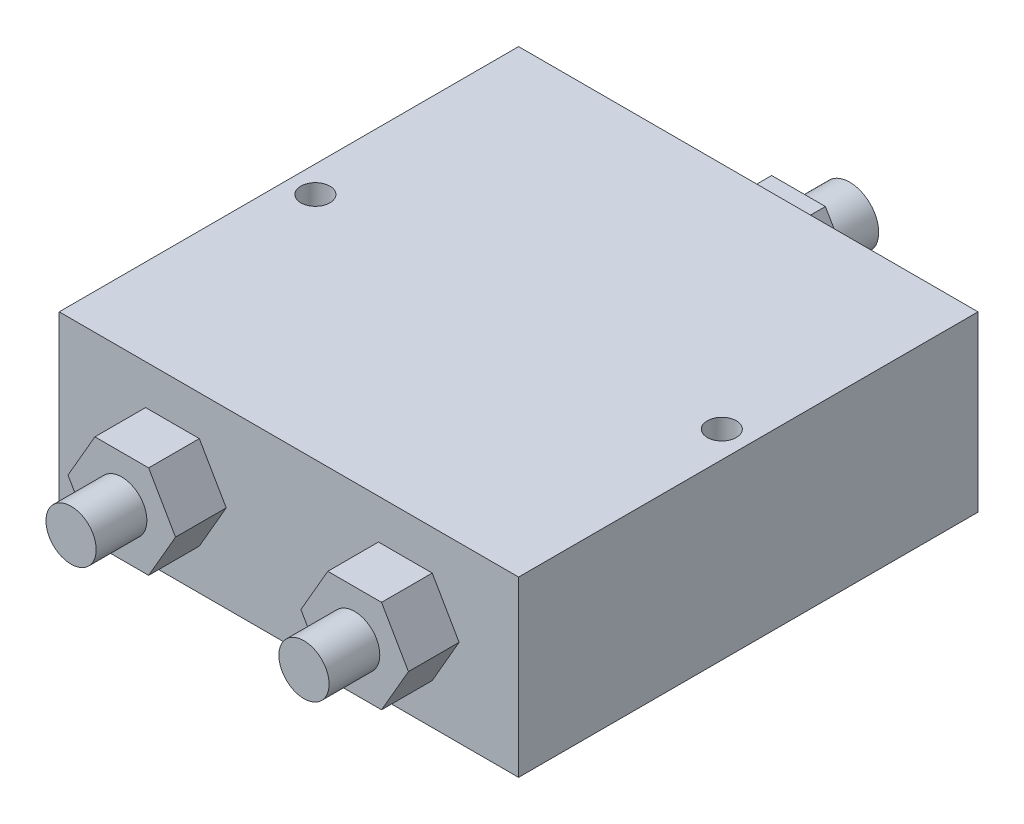
from build123d import *

# Parameters (mm, degrees)
SKETCH1_W           = 50.3
SKETCH1_H           = 50.3
BOSS_EXTRUDE1_DEPTH = 19
BOSS_EXTRUDE2_DEPTH = 5.55
BOSS_EXTRUDE3_DEPTH = 5.55
SKETCH5_R           = 3.175
BOSS_EXTRUDE4_DEPTH = 5.55
SKETCH7_R           = 2.75
BOSS_EXTRUDE5_DEPTH = 5.55
SKETCH8_R           = 1.59
CUT_EXTRUDE1_DEPTH  = 49.037329235


with BuildPart() as part:
    # Sketch1 → Boss-Extrude1 (new body)
    with BuildSketch(Plane(origin=(0, 0, 0), x_dir=(1, 0, 0), z_dir=(0, 1, 0))):
        Rectangle(SKETCH1_W, SKETCH1_H)
    extrude(amount=BOSS_EXTRUDE1_DEPTH)

    # Sketch2 → Boss-Extrude2 (add)
    with BuildSketch(Plane.XY.offset(25.15)):
        Polygon((-18.635756806, 9.551789092), (-15.692878403, 4.454574178), (-9.807121597, 4.454574178), (-6.864243194, 9.551789092), (-9.807121597, 14.649004006), (-15.692878403, 14.649004006), align=None)
        Polygon((9.807121597, 4.454574178), (15.692878403, 4.454574178), (18.635756806, 9.551789092), (15.692878403, 14.649004006), (9.807121597, 14.649004006), (6.864243194, 9.551789092), align=None)
    extrude(amount=BOSS_EXTRUDE2_DEPTH)

    # Sketch4 → Boss-Extrude3 (add)
    with BuildSketch(Plane(origin=(0, 0, -25.15), x_dir=(-1, 0, 0), z_dir=(0, 0, -1))):
        Polygon((-5.835508644, 9.984378867), (-2.892754322, 4.887378867), (2.992754322, 4.887378867), (5.935508644, 9.984378867), (2.992754322, 15.081378867), (-2.892754322, 15.081378867), align=None)
    extrude(amount=BOSS_EXTRUDE3_DEPTH)

    # Sketch5 → Boss-Extrude4 (add)
    with BuildSketch(Plane(origin=(0, 0, -30.7), x_dir=(-1, 0, 0), z_dir=(0, 0, -1))):
        with Locations((0, 9.996378867)):
            Circle(SKETCH5_R)
    extrude(amount=BOSS_EXTRUDE4_DEPTH)

    # Sketch7 → Boss-Extrude5 (add)
    with BuildSketch(Plane.XY.offset(30.7)):
        with Locations((-12.750756806, 9.564004006)):
            Circle(SKETCH7_R)
        with Locations((12.750756806, 9.564004006)):
            Circle(SKETCH7_R)
    extrude(amount=BOSS_EXTRUDE5_DEPTH)

    # Sketch8 → Cut-Extrude1 (cut, through all)
    with BuildSketch(Plane(origin=(0, 19, 0), x_dir=(1, 0, 0), z_dir=(0, 1, 0))):
        with Locations((-22.25, 0)):
            Circle(SKETCH8_R)
        with Locations((22.25, 0)):
            Circle(SKETCH8_R)
    extrude(amount=-CUT_EXTRUDE1_DEPTH, mode=Mode.SUBTRACT)


solid = part.part
